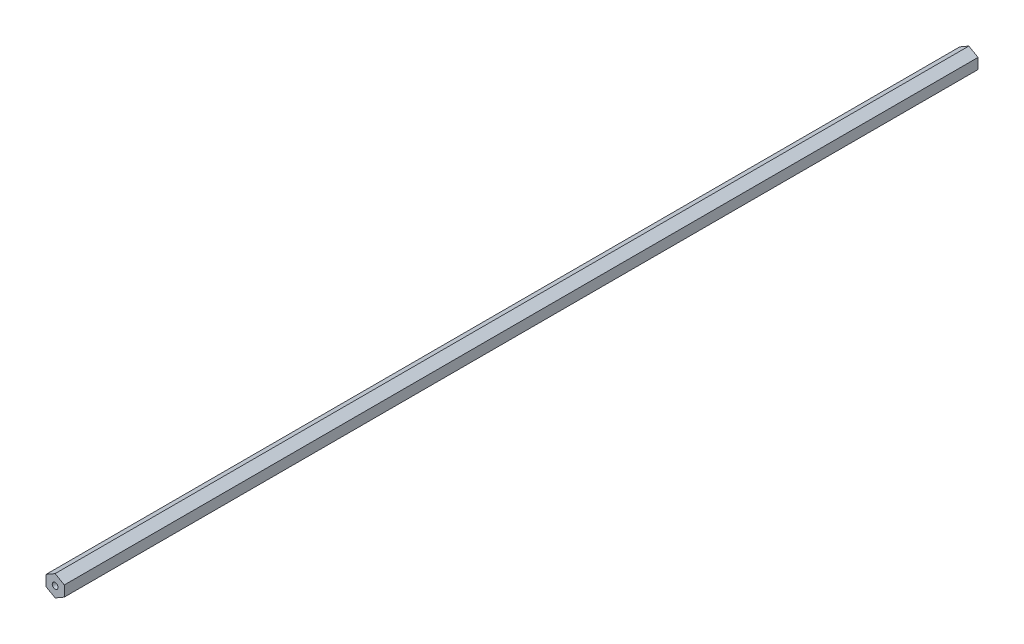
from build123d import *

# Parameters (mm, degrees)
BOSS_EXTRUDE1_DEPTH                  = 317.5
F_10_32_TAPPED_HOLE1_D               = 4.0386
F_10_32_TAPPED_HOLE1_DEPTH           = 16.34744
F_10_32_TAPPED_HOLE1_TIP             = 1.213317848
F_10_32_TAPPED_HOLE1_ON_FACE_2_D     = 4.0386
F_10_32_TAPPED_HOLE1_ON_FACE_2_DEPTH = 16.34744
F_10_32_TAPPED_HOLE1_ON_FACE_2_TIP   = 1.213317848


with BuildPart() as part:
    # Sketch1 → Boss-Extrude1 (new, symmetric)
    with BuildSketch(Plane.XY):
        Polygon((6.35, -3.666174209), (6.35, 3.666174209), (0, 7.332348419), (-6.35, 3.666174209), (-6.35, -3.666174209), (0, -7.332348419), align=None)
    extrude(amount=BOSS_EXTRUDE1_DEPTH, both=True)

    # #10-32 Tapped Hole1
    with Locations(Plane.XY.offset(317.5)):
        with Locations((0, 0)):
            Hole(F_10_32_TAPPED_HOLE1_D / 2, depth=F_10_32_TAPPED_HOLE1_DEPTH)
            with Locations((0, 0, -(F_10_32_TAPPED_HOLE1_DEPTH + F_10_32_TAPPED_HOLE1_TIP / 2))):  # 118° drill point
                Cone(0, F_10_32_TAPPED_HOLE1_D / 2, F_10_32_TAPPED_HOLE1_TIP, mode=Mode.SUBTRACT)

    # #10-32 Tapped Hole1 on face 2
    with Locations(Plane(origin=(0, 0, -317.5), x_dir=(-1, 0, 0), z_dir=(0, 0, -1))):
        with Locations((0, 0)):
            Hole(F_10_32_TAPPED_HOLE1_ON_FACE_2_D / 2, depth=F_10_32_TAPPED_HOLE1_ON_FACE_2_DEPTH)
            with Locations((0, 0, -(F_10_32_TAPPED_HOLE1_ON_FACE_2_DEPTH + F_10_32_TAPPED_HOLE1_ON_FACE_2_TIP / 2))):  # 118° drill point
                Cone(0, F_10_32_TAPPED_HOLE1_ON_FACE_2_D / 2, F_10_32_TAPPED_HOLE1_ON_FACE_2_TIP, mode=Mode.SUBTRACT)


solid = part.part
